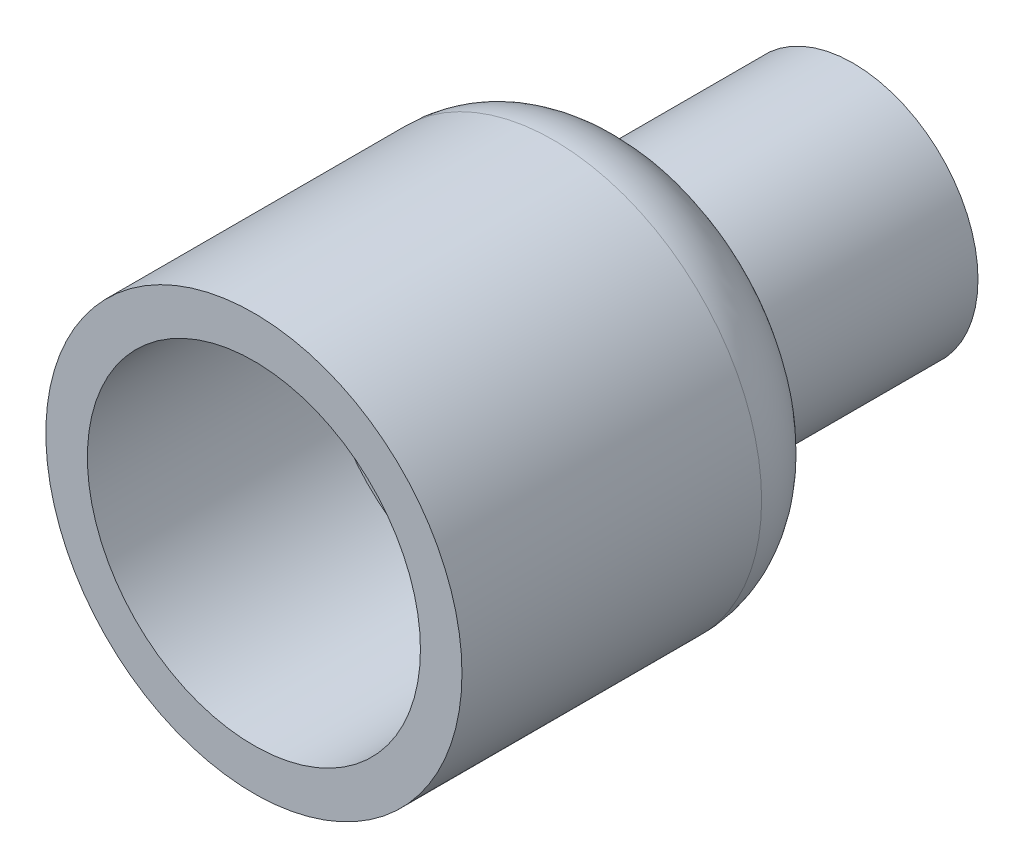
from build123d import *

# Parameters (mm, degrees)
SKETCH1_R                = 7.5
BOSS_EXTRUDE1_DEPTH      = 16
BOSS_EXTRUDE2_DEPTH      = 16
BOSS_EXTRUDE2_DEPTH_BACK = 7
SKETCH2_R                = 12.5
FILLET1_R                = 5
SKETCH4_R                = 10.005
CUT_EXTRUDE1_DEPTH       = 14
SKETCH3_R                = 5.005
CUT_EXTRUDE2_DEPTH       = 10


with BuildPart() as part:
    # Sketch1 → Boss-Extrude1 (new body)
    with BuildSketch(Plane.XY):
        Circle(SKETCH1_R)
    extrude(amount=BOSS_EXTRUDE1_DEPTH)

    # Sketch2 → Boss-Extrude2 (add, two sides: drawn at the far end of the back side and taken through both)
    with BuildSketch(Plane.XY.offset(20).offset(-BOSS_EXTRUDE2_DEPTH_BACK)):
        Circle(SKETCH2_R)
    extrude(amount=BOSS_EXTRUDE2_DEPTH + BOSS_EXTRUDE2_DEPTH_BACK)

    # Fillet1
    fillet1_edges = [part.edges().sort_by_distance(p)[0] for p in [
        (-12.5, 0, 13),
    ]]
    fillet(fillet1_edges, radius=FILLET1_R - 0.0001)  # a hair under: the kernel refuses the full size

    # Sketch4 → Cut-Extrude1 (cut)
    with BuildSketch(Plane.XY.offset(36)):
        Circle(SKETCH4_R)
    extrude(amount=-CUT_EXTRUDE1_DEPTH, mode=Mode.SUBTRACT)

    # Sketch3 → Cut-Extrude2 (cut)
    with BuildSketch(Plane(origin=(0, 0, 0), x_dir=(-1, 0, 0), z_dir=(0, 0, -1))):
        Circle(SKETCH3_R)
    extrude(amount=-CUT_EXTRUDE2_DEPTH, mode=Mode.SUBTRACT)


solid = part.part
